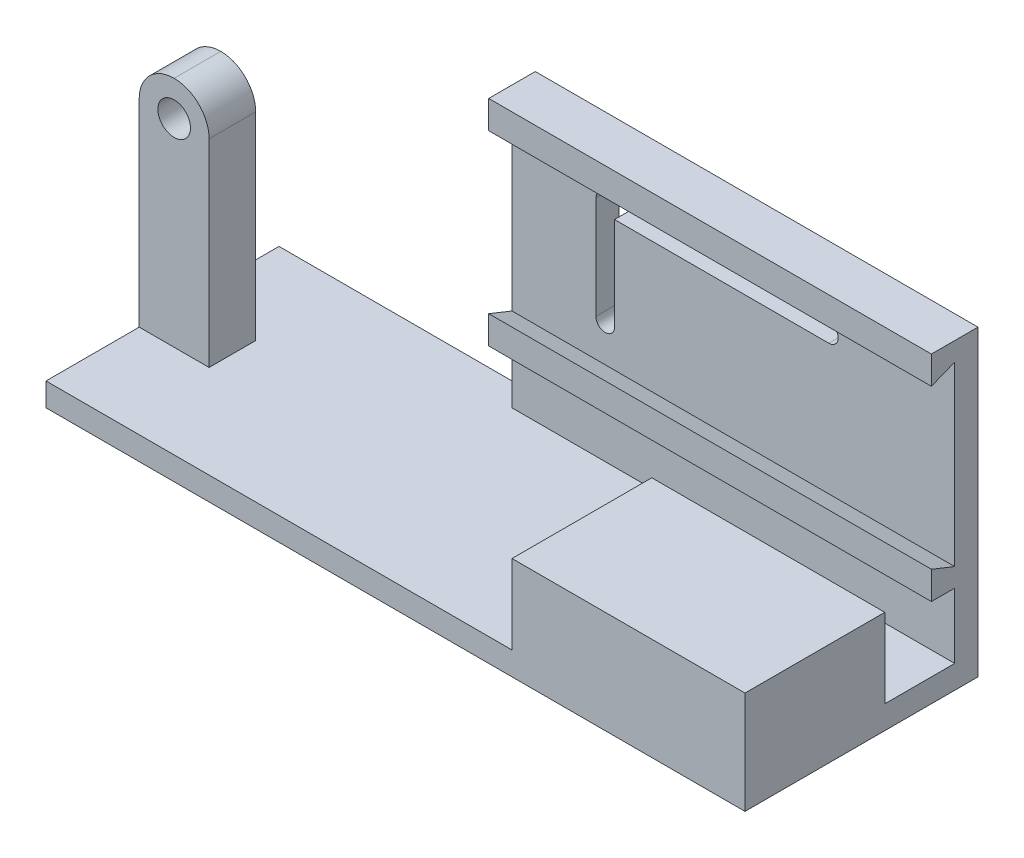
from build123d import *

# Parameters (mm, degrees)
SKETCH1_W           = 150
SKETCH1_H           = 5
BOSS_EXTRUDE1_DEPTH = 50
SKETCH2_W           = 15
SKETCH2_H           = 10
BOSS_EXTRUDE2_DEPTH = 50
SKETCH3_W           = 95
SKETCH3_H           = 5
BOSS_EXTRUDE3_DEPTH = 60
SKETCH4_W           = 50
SKETCH4_H           = 30
BOSS_EXTRUDE4_DEPTH = 17
BOSS_EXTRUDE5_DEPTH = 95
FILLET1_R           = 7.5
SKETCH6_R           = 3.5
CUT_EXTRUDE1_DEPTH  = 30
CUT_EXTRUDE2_DEPTH  = 10
CUT_EXTRUDE3_DEPTH  = 10
SCALE1_SCALE        = 2
SCALE4_SCALE        = 0.5


with BuildPart() as part:
    # Sketch1 → Boss-Extrude1 (new body)
    with BuildSketch(Plane.XY):
        with Locations((75, 2.5)):
            Rectangle(SKETCH1_W, SKETCH1_H)
    extrude(amount=-BOSS_EXTRUDE1_DEPTH)

    # Sketch2 → Boss-Extrude2 (add)
    with BuildSketch(Plane(origin=(0, 5, 0), x_dir=(1, 0, 0), z_dir=(0, 1, 0))):
        with Locations((7.5, 25)):
            Rectangle(SKETCH2_W, SKETCH2_H)
    extrude(amount=BOSS_EXTRUDE2_DEPTH)

    # Sketch3 → Boss-Extrude3 (add)
    with BuildSketch(Plane(origin=(0, 5, 0), x_dir=(1, 0, 0), z_dir=(0, 1, 0))):
        with Locations((102.5, 47.5)):
            Rectangle(SKETCH3_W, SKETCH3_H)
    extrude(amount=BOSS_EXTRUDE3_DEPTH)

    # Sketch4 → Boss-Extrude4 (add)
    with BuildSketch(Plane(origin=(0, 5, 0), x_dir=(1, 0, 0), z_dir=(0, 1, 0))):
        with Locations((125, 15)):
            Rectangle(SKETCH4_W, SKETCH4_H)
    extrude(amount=BOSS_EXTRUDE4_DEPTH)

    # Sketch5 → Boss-Extrude5 (add)
    with BuildSketch(Plane(origin=(150, 0, 0), x_dir=(0, 0, -1), z_dir=(1, 0, 0))):
        Polygon((45, 65), (40, 65), (40, 59), (45, 61), align=None)
        Polygon((45, 19), (40, 19), (40, 25), (45, 23), align=None)
    extrude(amount=-BOSS_EXTRUDE5_DEPTH)

    # Fillet1
    fillet1_edges = [part.edges().sort_by_distance(p)[0] for p in [
        (15, 55, -25),
        (0, 55, -25),
    ]]
    fillet(fillet1_edges, radius=FILLET1_R - 0.0001)  # a hair under: the kernel refuses the full size

    # Sketch6 → Cut-Extrude1 (cut)
    with BuildSketch(Plane.XY.offset(-20)):
        with Locations((7.5, 47.5)):
            Circle(SKETCH6_R)
    extrude(amount=-CUT_EXTRUDE1_DEPTH, mode=Mode.SUBTRACT)

    # Sketch7 → Cut-Extrude2 (cut)
    with BuildSketch(Plane.XY.offset(-45)):
        with BuildLine():
            Line((75, 55), (123, 55))
            ThreePointArc((123, 55), (125, 53), (123, 51))
            Line((123, 51), (75, 51))
            ThreePointArc((75, 51), (73, 53), (75, 55))
        make_face()
    extrude(amount=-CUT_EXTRUDE2_DEPTH, mode=Mode.SUBTRACT)

    # Sketch8 → Cut-Extrude3 (cut)
    with BuildSketch(Plane.XY.offset(-45)):
        with BuildLine():
            Line((77, 53), (77, 31))
            ThreePointArc((77, 31), (75, 29), (73, 31))
            Line((73, 31), (73, 53))
            ThreePointArc((73, 53), (75, 55), (77, 53))
        make_face()
    extrude(amount=-CUT_EXTRUDE3_DEPTH, mode=Mode.SUBTRACT)


with BuildPart() as part_1:
    # Scale1: scaled about (91.729979694, 17.282886664, -29.286286863)
    add(part.part.scale(SCALE1_SCALE).moved(Location((-91.729979694, -17.282886664, 29.286286863))))


with BuildPart() as part_2:
    # Scale4: scaled about (91.729979694, 17.282886664, -29.286286864)
    add(part_1.part.scale(SCALE4_SCALE).moved(Location((45.864989847, 8.641443332, -14.643143432))))


solid = part_2.part
